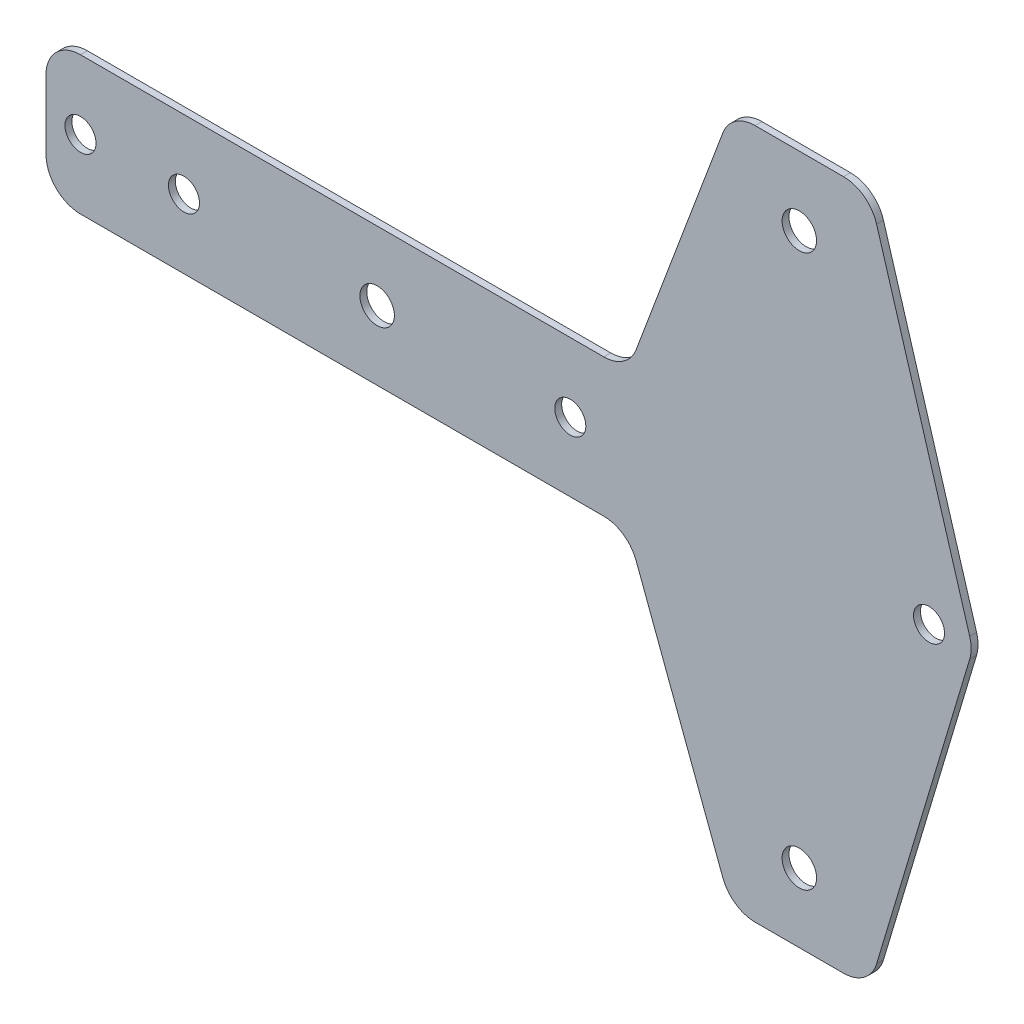
from build123d import *

# Parameters (mm, degrees)
SKETCH2_R          = 2.5
SKETCH2_R_2        = 2.25
BASE_FLANGE1_DEPTH = 1


# Sheet-metal steps are written as plain solids
with BuildPart() as part:
    # Sketch2 → Base-Flange1 (new body)
    with BuildSketch(Plane.XY):
        with BuildLine():
            Line((-62.163787728, 10), (13.698785388, 10))
            ThreePointArc((13.698785388, 10), (16.546759576, 10.890371912), (18.380431275, 13.244382792))
            Line((18.380431275, 13.244382792), (30.947144181, 46.755617208))
            ThreePointArc((30.947144181, 46.755617208), (32.78081588, 49.109628088), (35.628790069, 50))
            Line((35.628790069, 50), (48.443634474, 50))
            ThreePointArc((48.443634474, 50), (51.428287122, 49.011464641), (53.2327659, 46.436739428))
            Line((53.2327659, 46.436739428), (66.7327659, 1.436739428))
            ThreePointArc((66.7327659, 1.436739428), (66.943634474, 0), (66.7327659, -1.436739428))
            Line((66.7327659, -1.436739428), (53.2327659, -46.436739428))
            ThreePointArc((53.2327659, -46.436739428), (51.428287122, -49.011464641), (48.443634474, -50))
            Line((48.443634474, -50), (35.628790069, -50))
            ThreePointArc((35.628790069, -50), (32.78081588, -49.109628088), (30.947144181, -46.755617208))
            Line((30.947144181, -46.755617208), (18.380431275, -13.244382792))
            ThreePointArc((18.380431275, -13.244382792), (16.546759576, -10.890371912), (13.698785388, -10))
            Line((13.698785388, -10), (-62.163787728, -10))
            ThreePointArc((-62.163787728, -10), (-65.699321634, -8.535533906), (-67.163787728, -5))
            Line((-67.163787728, -5), (-67.163787728, 5))
            ThreePointArc((-67.163787728, 5), (-65.699321634, 8.535533906), (-62.163787728, 10))
        make_face()
        with Locations((-19.163787728, 0)):
            Circle(SKETCH2_R, mode=Mode.SUBTRACT)
        with Locations((42.036212272, 40)):
            Circle(SKETCH2_R, mode=Mode.SUBTRACT)
        with Locations((42.036212272, -40)):
            Circle(SKETCH2_R, mode=Mode.SUBTRACT)
        with Locations((-62.163787728, 0)):
            Circle(SKETCH2_R_2, mode=Mode.SUBTRACT)
        with Locations((-47.163787728, 0)):
            Circle(SKETCH2_R_2, mode=Mode.SUBTRACT)
        with Locations((8.836212272, 0)):
            Circle(SKETCH2_R_2, mode=Mode.SUBTRACT)
        with Locations((60.836212272, 0)):
            Circle(SKETCH2_R_2, mode=Mode.SUBTRACT)
    extrude(amount=-BASE_FLANGE1_DEPTH)


solid = part.part
